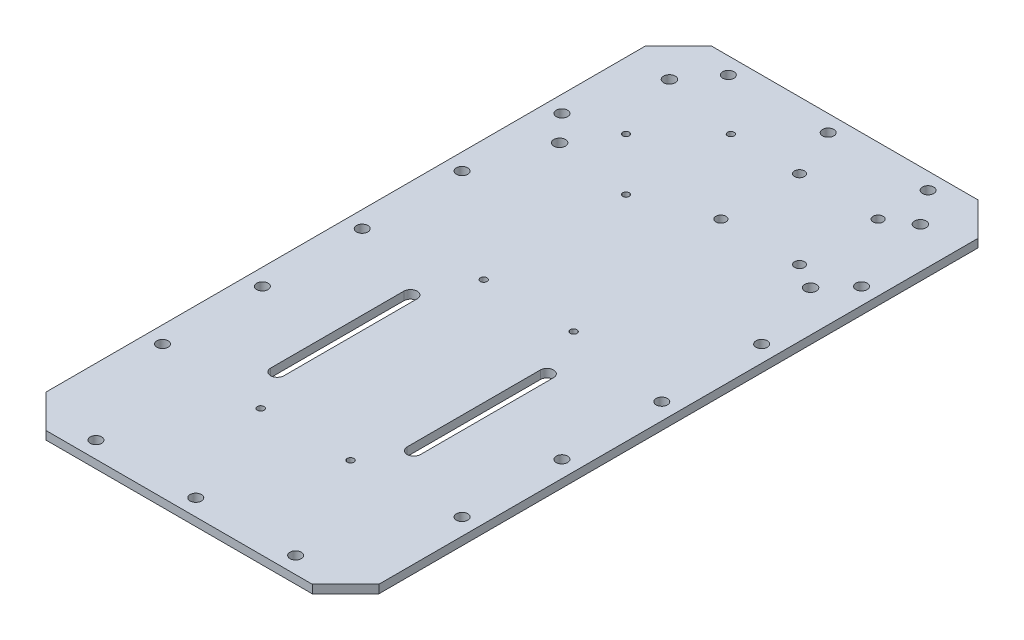
from build123d import *

# Parameters (mm, degrees)
SKETCH2_R           = 2.159
SKETCH2_R_2         = 1.27
SKETCH2_R_3         = 1.25
SKETCH2_R_4         = 2.2225
SKETCH2_R_5         = 1.905
BOSS_EXTRUDE1_DEPTH = 3.175


with BuildPart() as part:
    # Sketch2 → Boss-Extrude1 (new body)
    with BuildSketch(Plane(origin=(0, 0, 0), x_dir=(1, 0, 0), z_dir=(0, 1, 0))):
        Polygon((0, 241.3), (0, 12.7), (12.7, 0), (114.3, 0), (127, 12.7), (127, 241.3), (114.3, 254), (12.7, 254), align=None)
        with Locations((25.4, 6.35)):
            Circle(SKETCH2_R, mode=Mode.SUBTRACT)
        with Locations((6.35, 50.8)):
            Circle(SKETCH2_R, mode=Mode.SUBTRACT)
        with Locations((63.5, 6.35)):
            Circle(SKETCH2_R, mode=Mode.SUBTRACT)
        with Locations((46.355, 48.26)):
            Circle(SKETCH2_R_2, mode=Mode.SUBTRACT)
        with Locations((6.35, 88.9)):
            Circle(SKETCH2_R, mode=Mode.SUBTRACT)
        with BuildLine():
            Line((34.92, 63.5), (34.92, 114.3))
            ThreePointArc((34.92, 114.3), (37.46, 116.84), (40, 114.3))
            Line((40, 114.3), (40, 63.5))
            ThreePointArc((40, 63.5), (37.46, 60.96), (34.92, 63.5))
        make_face(mode=Mode.SUBTRACT)
        with Locations((80.645, 48.26)):
            Circle(SKETCH2_R_2, mode=Mode.SUBTRACT)
        with Locations((101.6, 6.35)):
            Circle(SKETCH2_R, mode=Mode.SUBTRACT)
        with Locations((120.65, 50.8)):
            Circle(SKETCH2_R, mode=Mode.SUBTRACT)
        with BuildLine():
            ThreePointArc((87, 114.3), (89.54, 116.84), (92.08, 114.3))
            Line((92.08, 114.3), (92.08, 63.5))
            ThreePointArc((92.08, 63.5), (89.54, 60.96), (87, 63.5))
            Line((87, 63.5), (87, 114.3))
        make_face(mode=Mode.SUBTRACT)
        with Locations((120.65, 88.9)):
            Circle(SKETCH2_R, mode=Mode.SUBTRACT)
        with Locations((6.35, 127)):
            Circle(SKETCH2_R, mode=Mode.SUBTRACT)
        with Locations((6.35, 165.1)):
            Circle(SKETCH2_R, mode=Mode.SUBTRACT)
        with Locations((46.355, 133.35)):
            Circle(SKETCH2_R_2, mode=Mode.SUBTRACT)
        with Locations((45.4, 188.6)):
            Circle(SKETCH2_R_3, mode=Mode.SUBTRACT)
        with Locations((6.35, 203.2)):
            Circle(SKETCH2_R, mode=Mode.SUBTRACT)
        with Locations((15.621, 193.04)):
            Circle(SKETCH2_R_4, mode=Mode.SUBTRACT)
        with Locations((25.4, 208.6)):
            Circle(SKETCH2_R_3, mode=Mode.SUBTRACT)
        with Locations((15.621, 234.95)):
            Circle(SKETCH2_R_4, mode=Mode.SUBTRACT)
        with Locations((25.4, 247.65)):
            Circle(SKETCH2_R, mode=Mode.SUBTRACT)
        with Locations((45.4, 228.6)):
            Circle(SKETCH2_R_3, mode=Mode.SUBTRACT)
        with Locations((63.5, 247.65)):
            Circle(SKETCH2_R, mode=Mode.SUBTRACT)
        with Locations((80.645, 133.35)):
            Circle(SKETCH2_R_2, mode=Mode.SUBTRACT)
        with Locations((120.65, 127)):
            Circle(SKETCH2_R, mode=Mode.SUBTRACT)
        with Locations((120.65, 165.1)):
            Circle(SKETCH2_R, mode=Mode.SUBTRACT)
        with Locations((71.60006, 198.60006)):
            Circle(SKETCH2_R_5, mode=Mode.SUBTRACT)
        with Locations((71.60006, 228.6)):
            Circle(SKETCH2_R_5, mode=Mode.SUBTRACT)
        with Locations((101.6, 198.60006)):
            Circle(SKETCH2_R_5, mode=Mode.SUBTRACT)
        with Locations((111.379, 193.04)):
            Circle(SKETCH2_R_4, mode=Mode.SUBTRACT)
        with Locations((120.65, 203.2)):
            Circle(SKETCH2_R, mode=Mode.SUBTRACT)
        with Locations((101.6, 228.6)):
            Circle(SKETCH2_R_5, mode=Mode.SUBTRACT)
        with Locations((101.6, 247.65)):
            Circle(SKETCH2_R, mode=Mode.SUBTRACT)
        with Locations((111.379, 234.95)):
            Circle(SKETCH2_R_4, mode=Mode.SUBTRACT)
    extrude(amount=BOSS_EXTRUDE1_DEPTH)


solid = part.part
